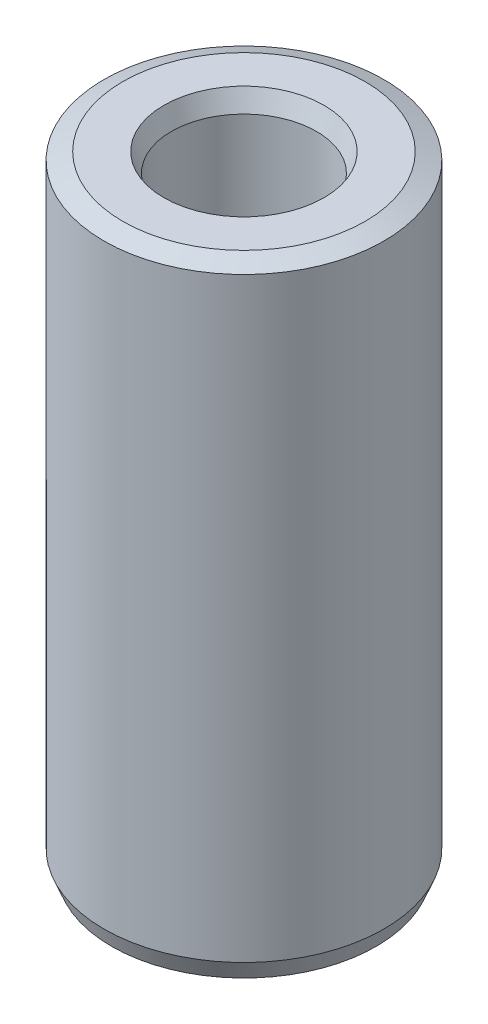
from build123d import *
from OCP.BRepFilletAPI import BRepFilletAPI_MakeChamfer

# Parameters (mm, degrees)
SKETCH1_R           = 32.5
BOSS_EXTRUDE1_DEPTH = 144.508683664
SKETCH2_R           = 16.837368765
CUT_EXTRUDE1_DEPTH  = 152.641879619
CHAMFER1_SIZE       = 1.762232722
CHAMFER1_SIZE2      = 4.369693862


with BuildPart() as part:
    # Sketch1 → Boss-Extrude1 (new body)
    with BuildSketch(Plane(origin=(0, 0, 0), x_dir=(1, 0, 0), z_dir=(0, 1, 0))):
        Circle(SKETCH1_R)
    extrude(amount=BOSS_EXTRUDE1_DEPTH)

    # Sketch2 → Cut-Extrude1 (cut, through all)
    with BuildSketch(Plane(origin=(0, 0, 0), x_dir=(1, 0, 0), z_dir=(0, 1, 0))):
        Circle(SKETCH2_R)
    extrude(amount=CUT_EXTRUDE1_DEPTH, mode=Mode.SUBTRACT)

    # Chamfer1: one chamfer whose edges measure the first distance from different faces: ONE call of the kernel's chamfer builder (chamfer() names one face for all edges)
    chamfer1_edges_1 = [part.edges().sort_by_distance(p)[0] for p in [
        (-16.837368765, 144.508683664, 0),
    ]]
    chamfer1_side_1 = [part.faces().sort_by_distance(p)[0] for p in [
        (-31.580761184, 144.508683664, 0),
    ]]
    chamfer1_edges_2 = [part.edges().sort_by_distance(p)[0] for p in [
        (-16.837368765, 0, 0),
    ]]
    chamfer1_side_2 = [part.faces().sort_by_distance(p)[0] for p in [
        (-16.837368765, 72.254341832, 0),
    ]]
    chamfer1_edges_3 = [part.edges().sort_by_distance(p)[0] for p in [
        (-32.5, 0, 0),
    ]]
    chamfer1_side_3 = [part.faces().sort_by_distance(p)[0] for p in [
        (-31.580761184, 0, 0),
    ]]
    chamfer1_edges_4 = [part.edges().sort_by_distance(p)[0] for p in [
        (-32.5, 144.508683664, 0),
    ]]
    chamfer1_side_4 = [part.faces().sort_by_distance(p)[0] for p in [
        (-32.5, 72.254341832, 0),
    ]]
    chamfer1 = BRepFilletAPI_MakeChamfer(part.part.solid().wrapped)
    for e in chamfer1_edges_1:
        chamfer1.Add(CHAMFER1_SIZE, CHAMFER1_SIZE2, e.wrapped, chamfer1_side_1[0].wrapped)  # the first distance lies on this face
    for e in chamfer1_edges_2:
        chamfer1.Add(CHAMFER1_SIZE, CHAMFER1_SIZE2, e.wrapped, chamfer1_side_2[0].wrapped)  # the first distance lies on this face
    for e in chamfer1_edges_3:
        chamfer1.Add(CHAMFER1_SIZE, CHAMFER1_SIZE2, e.wrapped, chamfer1_side_3[0].wrapped)  # the first distance lies on this face
    for e in chamfer1_edges_4:
        chamfer1.Add(CHAMFER1_SIZE, CHAMFER1_SIZE2, e.wrapped, chamfer1_side_4[0].wrapped)  # the first distance lies on this face
    add(Compound.cast(chamfer1.Shape()), mode=Mode.REPLACE)


solid = part.part
